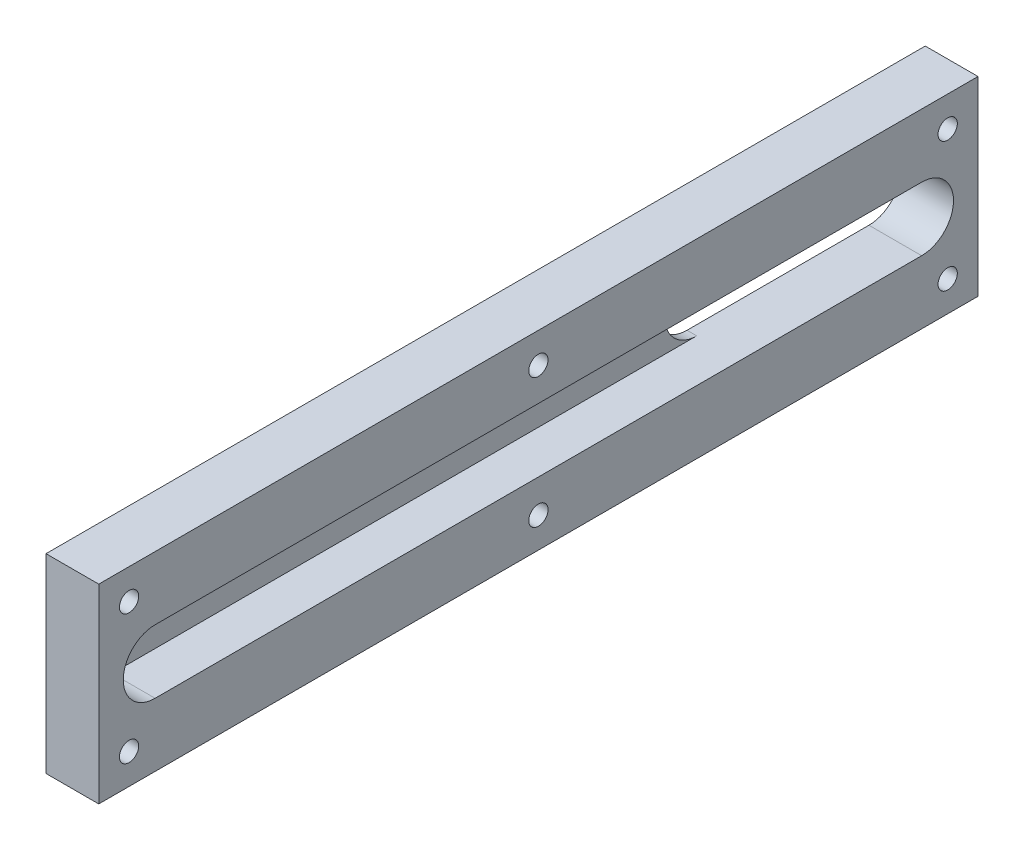
from build123d import *

# Parameters (mm, degrees)
SKETCH1_W              = 184.15
SKETCH1_H              = 39.878
BOSS_EXTRUDE1_DEPTH    = 11.049
F_10_32_TAPPED_HOLE1_D = 4.0386
BOSS_EXTRUDE2_DEPTH    = 2.032


with BuildPart() as part:
    # Sketch1 → Boss-Extrude1 (new body)
    with BuildSketch(Plane(origin=(0, 0, 0), x_dir=(0, 0, -1), z_dir=(1, 0, 0))):
        Rectangle(SKETCH1_W, SKETCH1_H)
        with BuildLine():
            Line((-80.27524839, 6.6675), (80.27524839, 6.6675))
            ThreePointArc((80.27524839, 6.6675), (86.94274839, 0), (80.27524839, -6.6675))
            Line((80.27524839, -6.6675), (-80.27524839, -6.6675))
            ThreePointArc((-80.27524839, -6.6675), (-86.94274839, 0), (-80.27524839, 6.6675))
        make_face(mode=Mode.SUBTRACT)
    extrude(amount=BOSS_EXTRUDE1_DEPTH)

    # #10-32 Tapped Hole1 (through all)
    with Locations(Plane(origin=(11.049, 0, 0), x_dir=(0, 0, -1), z_dir=(1, 0, 0))):
        with Locations((-85.725, 13.589), (-85.725, -13.589), (0, -13.589), (85.725, -13.589), (85.725, 13.589), (0, 13.589)):
            Hole(F_10_32_TAPPED_HOLE1_D / 2)

    # Sketch5 → Boss-Extrude2 (add)
    with BuildSketch(Plane.ZY):
        with BuildLine():
            Line((-42.17524839, -6.6675), (80.27524839, -6.6675))
            ThreePointArc((80.27524839, -6.6675), (86.94274839, 0), (80.27524839, 6.6675))
            Line((80.27524839, 6.6675), (-42.17524839, 6.6675))
            ThreePointArc((-42.17524839, 6.6675), (-35.50774839, 0), (-42.17524839, -6.6675))
        make_face()
    extrude(amount=-BOSS_EXTRUDE2_DEPTH)


solid = part.part
